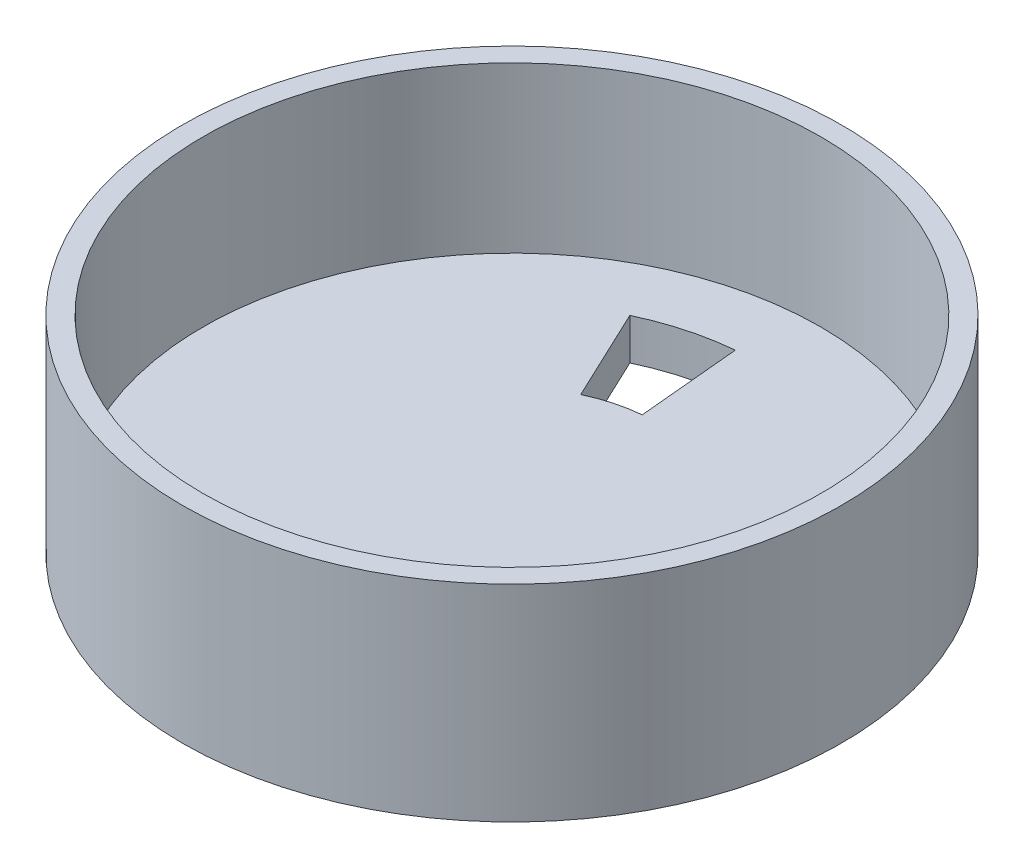
from build123d import *

# Parameters (mm, degrees)
SKETCH1_R           = 16
BOSS_EXTRUDE1_DEPTH = 10
SKETCH2_R           = 15
CUT_EXTRUDE1_DEPTH  = 8
CUT_EXTRUDE2_DEPTH  = 8


with BuildPart() as part:
    # Sketch1 → Boss-Extrude1 (new body)
    with BuildSketch(Plane(origin=(0, 0, 0), x_dir=(1, 0, 0), z_dir=(0, 1, 0))):
        Circle(SKETCH1_R)
    extrude(amount=BOSS_EXTRUDE1_DEPTH)

    # Sketch2 → Cut-Extrude1 (cut)
    with BuildSketch(Plane(origin=(0, 10, 0), x_dir=(1, 0, 0), z_dir=(0, 1, 0))):
        Circle(SKETCH2_R)
    extrude(amount=-CUT_EXTRUDE1_DEPTH, mode=Mode.SUBTRACT)

    # Sketch3 → Cut-Extrude2 (cut)
    with BuildSketch(Plane(origin=(0, 2, 0), x_dir=(1, 0, 0), z_dir=(0, 1, 0))):
        with BuildLine():
            Line((-5.12559773, 10.850264877), (-2.989932009, 6.329321179))
            ThreePointArc((-2.989932009, 6.329321179), (-1.845433135, 6.752360813), (-0.644861709, 6.97023338))
            Line((-0.644861709, 6.97023338), (-1.105477215, 11.948971509))
            ThreePointArc((-1.105477215, 11.948971509), (-3.16359966, 11.575475679), (-5.12559773, 10.850264877))
        make_face()
        with BuildLine():
            Line((5.12559773, -10.850264877), (2.989932009, -6.329321179))
            ThreePointArc((2.989932009, -6.329321179), (1.845433135, -6.752360813), (0.644861709, -6.97023338))
            Line((0.644861709, -6.97023338), (1.105477215, -11.948971509))
            ThreePointArc((1.105477215, -11.948971509), (3.16359966, -11.575475679), (5.12559773, -10.850264877))
        make_face()
    extrude(amount=-CUT_EXTRUDE2_DEPTH, mode=Mode.SUBTRACT)


solid = part.part
